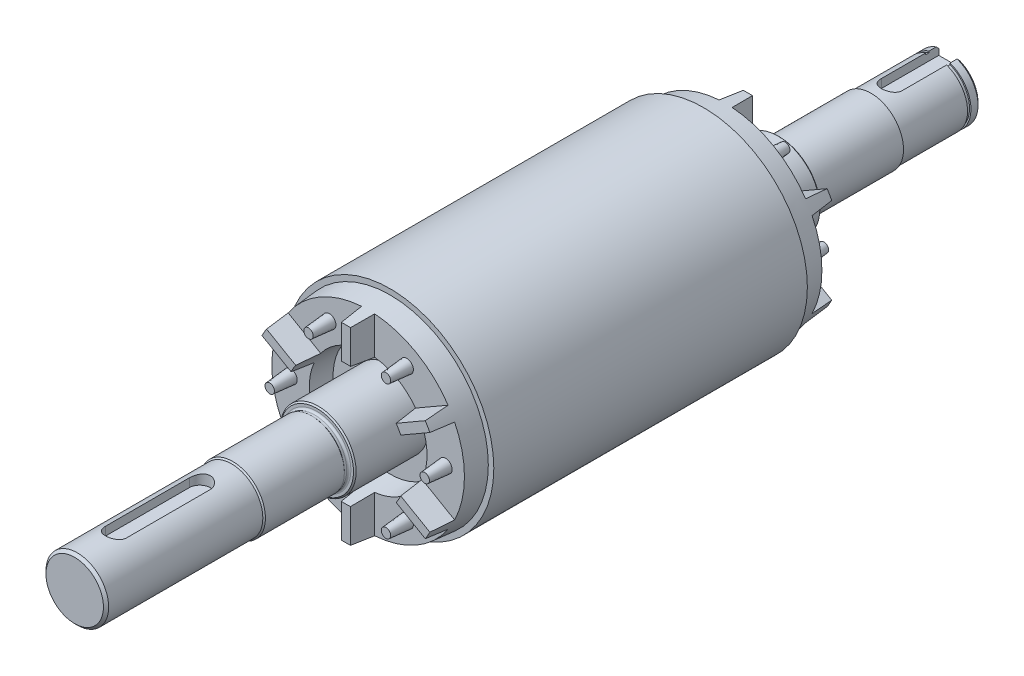
from build123d import *

# Parameters (mm, degrees)
SKETCH_1_R                 = 39.7
EXTRUDE_1_DEPTH            = 60
SKETCH_2_R                 = 37.6
SKETCH_2_R_2               = 21.8
EXTRUDE_2_DEPTH            = 8.4
EXTRUDE_2_DRAFT            = 5
EXTRUDE_3_DEPTH            = 8.5
EXTRUDE_3_DRAFT            = 5
EXTRUDE_3_PROFILE_2_DEPTH  = 8.5
EXTRUDE_3_PROFILE_2_DRAFT  = 5
EXTRUDE_3_PROFILE_3_DEPTH  = 8.5
EXTRUDE_3_PROFILE_3_DRAFT  = 5
EXTRUDE_3_PROFILE_4_DEPTH  = 8.5
EXTRUDE_3_PROFILE_4_DRAFT  = 5
EXTRUDE_3_PROFILE_5_DEPTH  = 8.5
EXTRUDE_3_PROFILE_5_DRAFT  = 5
EXTRUDE_3_PROFILE_6_DEPTH  = 8.5
EXTRUDE_3_PROFILE_6_DRAFT  = 5
SKETCH_4_R                 = 2.5
EXTRUDE_4_DEPTH            = 8
EXTRUDE_4_DRAFT            = 5
EXTRUDE_4_PROFILE_2_DEPTH  = 8
EXTRUDE_4_PROFILE_2_DRAFT  = 5
EXTRUDE_4_PROFILE_3_DEPTH  = 8
EXTRUDE_4_PROFILE_3_DRAFT  = 5
EXTRUDE_4_PROFILE_4_DEPTH  = 8
EXTRUDE_4_PROFILE_4_DRAFT  = 5
EXTRUDE_4_PROFILE_5_DEPTH  = 8
EXTRUDE_4_PROFILE_5_DRAFT  = 5
EXTRUDE_4_PROFILE_6_DEPTH  = 8
EXTRUDE_4_PROFILE_6_DRAFT  = 5
MIRROR_1_COPY_1_SKETCH_R   = 37.6
MIRROR_1_COPY_1_SKETCH_R_2 = 21.8
MIRROR_1_COPY_1_DEPTH      = 8.4
MIRROR_1_COPY_1_DRAFT      = 5
MIRROR_1_COPY_2_DEPTH      = 8.5
MIRROR_1_COPY_2_DRAFT      = 5
MIRROR_1_COPY_3_DEPTH      = 8.5
MIRROR_1_COPY_3_DRAFT      = 5
MIRROR_1_COPY_4_DEPTH      = 8.5
MIRROR_1_COPY_4_DRAFT      = 5
MIRROR_1_COPY_5_DEPTH      = 8.5
MIRROR_1_COPY_5_DRAFT      = 5
MIRROR_1_COPY_6_DEPTH      = 8.5
MIRROR_1_COPY_6_DRAFT      = 5
MIRROR_1_COPY_7_DEPTH      = 8.5
MIRROR_1_COPY_7_DRAFT      = 5
MIRROR_1_COPY_8_DEPTH      = 8.5
MIRROR_1_COPY_8_DRAFT      = 5
MIRROR_1_COPY_9_DEPTH      = 8.5
MIRROR_1_COPY_9_DRAFT      = 5
MIRROR_1_COPY_10_DEPTH     = 8.5
MIRROR_1_COPY_10_DRAFT     = 5
MIRROR_1_COPY_11_DEPTH     = 8.5
MIRROR_1_COPY_11_DRAFT     = 5
MIRROR_1_COPY_12_DEPTH     = 8.5
MIRROR_1_COPY_12_DRAFT     = 5
MIRROR_1_COPY_13_SKETCH_R  = 2.5
MIRROR_1_COPY_13_DEPTH     = 8
MIRROR_1_COPY_13_DRAFT     = 5
MIRROR_1_COPY_14_SKETCH_R  = 2.5
MIRROR_1_COPY_14_DEPTH     = 8
MIRROR_1_COPY_14_DRAFT     = 5
MIRROR_1_COPY_15_SKETCH_R  = 2.5
MIRROR_1_COPY_15_DEPTH     = 8
MIRROR_1_COPY_15_DRAFT     = 5
MIRROR_1_COPY_16_SKETCH_R  = 2.5
MIRROR_1_COPY_16_DEPTH     = 8
MIRROR_1_COPY_16_DRAFT     = 5
MIRROR_1_COPY_17_SKETCH_R  = 2.5
MIRROR_1_COPY_17_DEPTH     = 8
MIRROR_1_COPY_17_DRAFT     = 5
MIRROR_1_COPY_18_SKETCH_R  = 2.5
MIRROR_1_COPY_18_DEPTH     = 8
MIRROR_1_COPY_18_DRAFT     = 5
MIRROR_1_COPY_19_SKETCH_R  = 2.5
MIRROR_1_COPY_19_DEPTH     = 8
MIRROR_1_COPY_19_DRAFT     = 5
MIRROR_1_COPY_20_SKETCH_R  = 2.5
MIRROR_1_COPY_20_DEPTH     = 8
MIRROR_1_COPY_20_DRAFT     = 5
MIRROR_1_COPY_21_SKETCH_R  = 2.5
MIRROR_1_COPY_21_DEPTH     = 8
MIRROR_1_COPY_21_DRAFT     = 5
MIRROR_1_COPY_22_SKETCH_R  = 2.5
MIRROR_1_COPY_22_DEPTH     = 8
MIRROR_1_COPY_22_DRAFT     = 5
MIRROR_1_COPY_23_SKETCH_R  = 2.5
MIRROR_1_COPY_23_DEPTH     = 8
MIRROR_1_COPY_23_DRAFT     = 5
SKETCH_6_R                 = 14.5
EXTRUDE_5_DEPTH            = 28
SKETCH_7_R                 = 12.2
EXTRUDE_6_DEPTH            = 1.7
SKETCH_8_R                 = 12.5
EXTRUDE_7_DEPTH            = 31
FILLET_1_R                 = 0.8
CHAMFER_1_SIZE             = 0.3
CHAMFER_3_SIZE             = 0.5
SKETCH_9_R                 = 12
EXTRUDE_8_DEPTH            = 60
CHAMFER_4_SIZE             = 0.5
CHAMFER_5_SIZE             = 1
CUT_EXTRUDE_9_DEPTH        = 4
SKETCH_11_R                = 16
EXTRUDE_10_DEPTH           = 29
EXTRUDE_START              = 1.7
SKETCH_12_R                = 12.2
EXTRUDE_11_DEPTH           = 1.7
EXTRUDE_START_2            = 33.3
SKETCH_13_R                = 12.5
EXTRUDE_12_DEPTH           = 33.3
FILLET_2_R                 = 0.8
CHAMFER_6_SIZE             = 0.3
CHAMFER_7_SIZE             = 0.5
EXTRUDE_START_3            = 25
SKETCH_14_R                = 12
EXTRUDE_13_DEPTH           = 25
SKETCH_15_R                = 11.45
EXTRUDE_14_DEPTH           = 1.3
EXTRUDE_START_4            = 3.7
SKETCH_16_R                = 12
EXTRUDE_15_DEPTH           = 3.7
CHAMFER_8_SIZE             = 1
CUT_EXTRUDE_16_DEPTH       = 4
SCALE_1_SCALE              = 0.25


with BuildPart() as part:
    # 草图1 → 拉伸1 (new body)
    with BuildSketch(Plane.XY):
        Circle(SKETCH_1_R)
    extrude_1 = extrude(amount=EXTRUDE_1_DEPTH)


with BuildPart() as extrude_2_tool:
    # 草图2 → 拉伸2 (with draft: the straight prism first)
    with BuildSketch(Plane.XY.offset(60)):
        Circle(SKETCH_2_R)
        Circle(SKETCH_2_R_2, mode=Mode.SUBTRACT)
    extrude(amount=EXTRUDE_2_DEPTH)
    # 拉伸2: the draft: its side faces are tilted about the plane it starts from
    extrude_2_sides = [extrude_2_tool.faces().sort_by_distance(p)[0] for p in [
        (-37.6, 0, 64.2),
        (-21.8, 0, 64.2),
    ]]
    draft(extrude_2_sides, Plane.XY.offset(60), EXTRUDE_2_DRAFT)


with BuildPart() as part_1:
    add(part.part)

    # 拉伸2: add extrude_2_tool
    add(extrude_2_tool.part)


with BuildPart() as extrude_3_tool:
    # 草图3 → 拉伸3 (with draft: the straight prism first)
    with BuildSketch(Plane.XY.offset(68.4)):
        with BuildLine():
            ThreePointArc((18.145333198, 13.362964352), (19.515800006, 11.267452387), (20.645333198, 9.032837334))
            Line((20.645333198, 9.032837334), (33.10261268, 16.225050996))
            ThreePointArc((33.10261268, 16.225050996), (31.926108979, 18.432547613), (30.60261268, 20.555178015))
            Line((30.60261268, 20.555178015), (18.145333198, 13.362964352))
        make_face()
    extrude(amount=EXTRUDE_3_DEPTH)
    # 拉伸3: the draft: its side faces are tilted about the plane it starts from
    extrude_3_sides = [extrude_3_tool.faces().sort_by_distance(p)[0] for p in [
        (24.373972939, 16.959071184, 72.65),
        (19.515800006, 11.267452387, 72.65),
        (26.873972939, 12.628944165, 72.65),
        (31.926108979, 18.432547613, 72.65),
    ]]
    draft(extrude_3_sides, Plane.XY.offset(68.4), EXTRUDE_3_DRAFT)


with BuildPart() as part_2:
    add(part_1.part)

    # 拉伸3: add extrude_3_tool
    add(extrude_3_tool.part)


with BuildPart() as extrude_3_profile_2_tool:
    # 草图3 → 拉伸3 profile 2 (with draft: the straight prism first)
    with BuildSketch(Plane.XY.offset(68.4)):
        with BuildLine():
            Line((2.5, 22.395801686), (2.5, 36.78022901))
            ThreePointArc((2.5, 36.78022901), (0, 36.865095226), (-2.5, 36.78022901))
            Line((-2.5, 36.78022901), (-2.5, 22.395801686))
            ThreePointArc((-2.5, 22.395801686), (0, 22.534904774), (2.5, 22.395801686))
        make_face()
    extrude(amount=EXTRUDE_3_PROFILE_2_DEPTH)
    # 拉伸3 profile 2: the draft: its side faces are tilted about the plane it starts from
    extrude_3_profile_2_sides = [extrude_3_profile_2_tool.faces().sort_by_distance(p)[0] for p in [
        (2.5, 29.588015348, 72.65),
        (0, 36.865095226, 72.65),
        (-2.5, 29.588015348, 72.65),
        (0, 22.534904774, 72.65),
    ]]
    draft(extrude_3_profile_2_sides, Plane.XY.offset(68.4), EXTRUDE_3_PROFILE_2_DRAFT)


with BuildPart() as part_3:
    add(part_2.part)

    # 拉伸3 profile 2: add extrude_3_profile_2_tool
    add(extrude_3_profile_2_tool.part)


with BuildPart() as extrude_3_profile_3_tool:
    # 草图3 → 拉伸3 profile 3 (with draft: the straight prism first)
    with BuildSketch(Plane.XY.offset(68.4)):
        with BuildLine():
            ThreePointArc((20.645333198, -9.032837334), (19.515800006, -11.267452387), (18.145333198, -13.362964352))
            Line((18.145333198, -13.362964352), (30.60261268, -20.555178015))
            ThreePointArc((30.60261268, -20.555178015), (31.926108979, -18.432547613), (33.10261268, -16.225050996))
            Line((33.10261268, -16.225050996), (20.645333198, -9.032837334))
        make_face()
    extrude(amount=EXTRUDE_3_PROFILE_3_DEPTH)
    # 拉伸3 profile 3: the draft: its side faces are tilted about the plane it starts from
    extrude_3_profile_3_sides = [extrude_3_profile_3_tool.faces().sort_by_distance(p)[0] for p in [
        (31.926108979, -18.432547613, 72.65),
        (26.873972939, -12.628944165, 72.65),
        (19.515800006, -11.267452387, 72.65),
        (24.373972939, -16.959071184, 72.65),
    ]]
    draft(extrude_3_profile_3_sides, Plane.XY.offset(68.4), EXTRUDE_3_PROFILE_3_DRAFT)


with BuildPart() as part_4:
    add(part_3.part)

    # 拉伸3 profile 3: add extrude_3_profile_3_tool
    add(extrude_3_profile_3_tool.part)


with BuildPart() as extrude_3_profile_4_tool:
    # 草图3 → 拉伸3 profile 4 (with draft: the straight prism first)
    with BuildSketch(Plane.XY.offset(68.4)):
        with BuildLine():
            ThreePointArc((2.5, -22.395801686), (0, -22.534904774), (-2.5, -22.395801686))
            Line((-2.5, -22.395801686), (-2.5, -36.78022901))
            ThreePointArc((-2.5, -36.78022901), (0, -36.865095226), (2.5, -36.78022901))
            Line((2.5, -36.78022901), (2.5, -22.395801686))
        make_face()
    extrude(amount=EXTRUDE_3_PROFILE_4_DEPTH)
    # 拉伸3 profile 4: the draft: its side faces are tilted about the plane it starts from
    extrude_3_profile_4_sides = [extrude_3_profile_4_tool.faces().sort_by_distance(p)[0] for p in [
        (2.5, -29.588015348, 72.65),
        (0, -22.534904774, 72.65),
        (-2.5, -29.588015348, 72.65),
        (0, -36.865095226, 72.65),
    ]]
    draft(extrude_3_profile_4_sides, Plane.XY.offset(68.4), EXTRUDE_3_PROFILE_4_DRAFT)


with BuildPart() as part_5:
    add(part_4.part)

    # 拉伸3 profile 4: add extrude_3_profile_4_tool
    add(extrude_3_profile_4_tool.part)


with BuildPart() as extrude_3_profile_5_tool:
    # 草图3 → 拉伸3 profile 5 (with draft: the straight prism first)
    with BuildSketch(Plane.XY.offset(68.4)):
        with BuildLine():
            ThreePointArc((-18.145333198, -13.362964352), (-19.515800006, -11.267452387), (-20.645333198, -9.032837334))
            Line((-20.645333198, -9.032837334), (-33.10261268, -16.225050996))
            ThreePointArc((-33.10261268, -16.225050996), (-31.926108979, -18.432547613), (-30.60261268, -20.555178015))
            Line((-30.60261268, -20.555178015), (-18.145333198, -13.362964352))
        make_face()
    extrude(amount=EXTRUDE_3_PROFILE_5_DEPTH)
    # 拉伸3 profile 5: the draft: its side faces are tilted about the plane it starts from
    extrude_3_profile_5_sides = [extrude_3_profile_5_tool.faces().sort_by_distance(p)[0] for p in [
        (-24.373972939, -16.959071184, 72.65),
        (-19.515800006, -11.267452387, 72.65),
        (-26.873972939, -12.628944165, 72.65),
        (-31.926108979, -18.432547613, 72.65),
    ]]
    draft(extrude_3_profile_5_sides, Plane.XY.offset(68.4), EXTRUDE_3_PROFILE_5_DRAFT)


with BuildPart() as part_6:
    add(part_5.part)

    # 拉伸3 profile 5: add extrude_3_profile_5_tool
    add(extrude_3_profile_5_tool.part)


with BuildPart() as extrude_3_profile_6_tool:
    # 草图3 → 拉伸3 profile 6 (with draft: the straight prism first)
    with BuildSketch(Plane.XY.offset(68.4)):
        with BuildLine():
            ThreePointArc((-20.645333198, 9.032837334), (-19.515800006, 11.267452387), (-18.145333198, 13.362964352))
            Line((-18.145333198, 13.362964352), (-30.60261268, 20.555178015))
            ThreePointArc((-30.60261268, 20.555178015), (-31.926108979, 18.432547613), (-33.10261268, 16.225050996))
            Line((-33.10261268, 16.225050996), (-20.645333198, 9.032837334))
        make_face()
    extrude(amount=EXTRUDE_3_PROFILE_6_DEPTH)
    # 拉伸3 profile 6: the draft: its side faces are tilted about the plane it starts from
    extrude_3_profile_6_sides = [extrude_3_profile_6_tool.faces().sort_by_distance(p)[0] for p in [
        (-19.515800006, 11.267452387, 72.65),
        (-24.373972939, 16.959071184, 72.65),
        (-31.926108979, 18.432547613, 72.65),
        (-26.873972939, 12.628944165, 72.65),
    ]]
    draft(extrude_3_profile_6_sides, Plane.XY.offset(68.4), EXTRUDE_3_PROFILE_6_DRAFT)


with BuildPart() as part_7:
    add(part_6.part)

    # 拉伸3 profile 6: add extrude_3_profile_6_tool
    add(extrude_3_profile_6_tool.part)


with BuildPart() as extrude_4_tool:
    # 草图4 → 拉伸4 (with draft: the straight prism first)
    with BuildSketch(Plane.XY.offset(68.4)):
        with Locations((-29.650684789, 0)):
            Circle(SKETCH_4_R)
    extrude(amount=EXTRUDE_4_DEPTH)
    # 拉伸4: the draft: its side faces are tilted about the plane it starts from
    extrude_4_sides = [extrude_4_tool.faces().sort_by_distance(p)[0] for p in [
        (-32.150684789, 0, 72.4),
    ]]
    draft(extrude_4_sides, Plane.XY.offset(68.4), EXTRUDE_4_DRAFT)


with BuildPart() as part_8:
    add(part_7.part)

    # 拉伸4: add extrude_4_tool
    add(extrude_4_tool.part)


with BuildPart() as extrude_4_profile_2_tool:
    # 草图4 → 拉伸4 profile 2 (with draft: the straight prism first)
    with BuildSketch(Plane.XY.offset(68.4)):
        with Locations((-14.825342394, 25.678246267)):
            Circle(SKETCH_4_R)
    extrude(amount=EXTRUDE_4_PROFILE_2_DEPTH)
    # 拉伸4 profile 2: the draft: its side faces are tilted about the plane it starts from
    extrude_4_profile_2_sides = [extrude_4_profile_2_tool.faces().sort_by_distance(p)[0] for p in [
        (-17.325342394, 25.678246267, 72.4),
    ]]
    draft(extrude_4_profile_2_sides, Plane.XY.offset(68.4), EXTRUDE_4_PROFILE_2_DRAFT)


with BuildPart() as part_9:
    add(part_8.part)

    # 拉伸4 profile 2: add extrude_4_profile_2_tool
    add(extrude_4_profile_2_tool.part)


with BuildPart() as extrude_4_profile_3_tool:
    # 草图4 → 拉伸4 profile 3 (with draft: the straight prism first)
    with BuildSketch(Plane.XY.offset(68.4)):
        with Locations((14.825342394, 25.678246267)):
            Circle(SKETCH_4_R)
    extrude(amount=EXTRUDE_4_PROFILE_3_DEPTH)
    # 拉伸4 profile 3: the draft: its side faces are tilted about the plane it starts from
    extrude_4_profile_3_sides = [extrude_4_profile_3_tool.faces().sort_by_distance(p)[0] for p in [
        (12.325342394, 25.678246267, 72.4),
    ]]
    draft(extrude_4_profile_3_sides, Plane.XY.offset(68.4), EXTRUDE_4_PROFILE_3_DRAFT)


with BuildPart() as part_10:
    add(part_9.part)

    # 拉伸4 profile 3: add extrude_4_profile_3_tool
    add(extrude_4_profile_3_tool.part)


with BuildPart() as extrude_4_profile_4_tool:
    # 草图4 → 拉伸4 profile 4 (with draft: the straight prism first)
    with BuildSketch(Plane.XY.offset(68.4)):
        with Locations((29.650684789, 0)):
            Circle(SKETCH_4_R)
    extrude(amount=EXTRUDE_4_PROFILE_4_DEPTH)
    # 拉伸4 profile 4: the draft: its side faces are tilted about the plane it starts from
    extrude_4_profile_4_sides = [extrude_4_profile_4_tool.faces().sort_by_distance(p)[0] for p in [
        (27.150684789, 0, 72.4),
    ]]
    draft(extrude_4_profile_4_sides, Plane.XY.offset(68.4), EXTRUDE_4_PROFILE_4_DRAFT)


with BuildPart() as part_11:
    add(part_10.part)

    # 拉伸4 profile 4: add extrude_4_profile_4_tool
    add(extrude_4_profile_4_tool.part)


with BuildPart() as extrude_4_profile_5_tool:
    # 草图4 → 拉伸4 profile 5 (with draft: the straight prism first)
    with BuildSketch(Plane.XY.offset(68.4)):
        with Locations((14.825342394, -25.678246267)):
            Circle(SKETCH_4_R)
    extrude(amount=EXTRUDE_4_PROFILE_5_DEPTH)
    # 拉伸4 profile 5: the draft: its side faces are tilted about the plane it starts from
    extrude_4_profile_5_sides = [extrude_4_profile_5_tool.faces().sort_by_distance(p)[0] for p in [
        (12.325342394, -25.678246267, 72.4),
    ]]
    draft(extrude_4_profile_5_sides, Plane.XY.offset(68.4), EXTRUDE_4_PROFILE_5_DRAFT)


with BuildPart() as part_12:
    add(part_11.part)

    # 拉伸4 profile 5: add extrude_4_profile_5_tool
    add(extrude_4_profile_5_tool.part)


with BuildPart() as extrude_4_profile_6_tool:
    # 草图4 → 拉伸4 profile 6 (with draft: the straight prism first)
    with BuildSketch(Plane.XY.offset(68.4)):
        with Locations((-14.825342394, -25.678246267)):
            Circle(SKETCH_4_R)
    extrude(amount=EXTRUDE_4_PROFILE_6_DEPTH)
    # 拉伸4 profile 6: the draft: its side faces are tilted about the plane it starts from
    extrude_4_profile_6_sides = [extrude_4_profile_6_tool.faces().sort_by_distance(p)[0] for p in [
        (-17.325342394, -25.678246267, 72.4),
    ]]
    draft(extrude_4_profile_6_sides, Plane.XY.offset(68.4), EXTRUDE_4_PROFILE_6_DRAFT)


with BuildPart() as part_13:
    add(part_12.part)

    # 拉伸4 profile 6: add extrude_4_profile_6_tool
    add(extrude_4_profile_6_tool.part)

    # 镜向1: 拉伸1 across plane
    add(extrude_1.mirror(Plane.XY))


with BuildPart() as mirror_1_copy_1_tool:
    # 镜向1 copy 1 sketch → 镜向1 copy 1 (with draft: the straight prism first)
    with BuildSketch(Plane(origin=(0, 0, -60), x_dir=(1, 0, 0), z_dir=(0, 0, -1))):
        Circle(MIRROR_1_COPY_1_SKETCH_R)
        Circle(MIRROR_1_COPY_1_SKETCH_R_2, mode=Mode.SUBTRACT)
    extrude(amount=MIRROR_1_COPY_1_DEPTH)
    # 镜向1 copy 1: the draft: its side faces are tilted about the plane it starts from
    mirror_1_copy_1_sides = [mirror_1_copy_1_tool.faces().sort_by_distance(p)[0] for p in [
        (-37.6, 0, -64.2),
        (-21.8, 0, -64.2),
    ]]
    draft(mirror_1_copy_1_sides, Plane(origin=(0, 0, -60), x_dir=(1, 0, 0), z_dir=(0, 0, -1)), MIRROR_1_COPY_1_DRAFT)


with BuildPart() as part_14:
    add(part_13.part)

    # 镜向1 copy 1: add mirror_1_copy_1_tool
    add(mirror_1_copy_1_tool.part)


with BuildPart() as mirror_1_copy_2_tool:
    # 镜向1 copy 2 sketch → 镜向1 copy 2 (with draft: the straight prism first)
    with BuildSketch(Plane(origin=(0, 0, -68.4), x_dir=(1, 0, 0), z_dir=(0, 0, -1))):
        with BuildLine():
            ThreePointArc((18.145333198, -13.362964352), (19.515800006, -11.267452387), (20.645333198, -9.032837334))
            Line((20.645333198, -9.032837334), (33.10261268, -16.225050996))
            ThreePointArc((33.10261268, -16.225050996), (31.926108979, -18.432547613), (30.60261268, -20.555178015))
            Line((30.60261268, -20.555178015), (18.145333198, -13.362964352))
        make_face()
    extrude(amount=MIRROR_1_COPY_2_DEPTH)
    # 镜向1 copy 2: the draft: its side faces are tilted about the plane it starts from
    mirror_1_copy_2_sides = [mirror_1_copy_2_tool.faces().sort_by_distance(p)[0] for p in [
        (24.373972939, 16.959071184, -72.65),
        (19.515800006, 11.267452387, -72.65),
        (26.873972939, 12.628944165, -72.65),
        (31.926108979, 18.432547613, -72.65),
    ]]
    draft(mirror_1_copy_2_sides, Plane(origin=(0, 0, -68.4), x_dir=(1, 0, 0), z_dir=(0, 0, -1)), MIRROR_1_COPY_2_DRAFT)


with BuildPart() as part_15:
    add(part_14.part)

    # 镜向1 copy 2: add mirror_1_copy_2_tool
    add(mirror_1_copy_2_tool.part)


with BuildPart() as mirror_1_copy_3_tool:
    # 镜向1 copy 3 sketch → 镜向1 copy 3 (with draft: the straight prism first)
    with BuildSketch(Plane(origin=(0, 0, -68.4), x_dir=(1, 0, 0), z_dir=(0, 0, -1))):
        with BuildLine():
            Line((2.5, -22.395801686), (2.5, -36.78022901))
            ThreePointArc((2.5, -36.78022901), (0, -36.865095226), (-2.5, -36.78022901))
            Line((-2.5, -36.78022901), (-2.5, -22.395801686))
            ThreePointArc((-2.5, -22.395801686), (0, -22.534904774), (2.5, -22.395801686))
        make_face()
    extrude(amount=MIRROR_1_COPY_3_DEPTH)
    # 镜向1 copy 3: the draft: its side faces are tilted about the plane it starts from
    mirror_1_copy_3_sides = [mirror_1_copy_3_tool.faces().sort_by_distance(p)[0] for p in [
        (2.5, 29.588015348, -72.65),
        (0, 36.865095226, -72.65),
        (-2.5, 29.588015348, -72.65),
        (0, 22.534904774, -72.65),
    ]]
    draft(mirror_1_copy_3_sides, Plane(origin=(0, 0, -68.4), x_dir=(1, 0, 0), z_dir=(0, 0, -1)), MIRROR_1_COPY_3_DRAFT)


with BuildPart() as part_16:
    add(part_15.part)

    # 镜向1 copy 3: add mirror_1_copy_3_tool
    add(mirror_1_copy_3_tool.part)


with BuildPart() as mirror_1_copy_4_tool:
    # 镜向1 copy 4 sketch → 镜向1 copy 4 (with draft: the straight prism first)
    with BuildSketch(Plane(origin=(0, 0, -68.4), x_dir=(1, 0, 0), z_dir=(0, 0, -1))):
        with BuildLine():
            ThreePointArc((20.645333198, 9.032837334), (19.515800006, 11.267452387), (18.145333198, 13.362964352))
            Line((18.145333198, 13.362964352), (30.60261268, 20.555178015))
            ThreePointArc((30.60261268, 20.555178015), (31.926108979, 18.432547613), (33.10261268, 16.225050996))
            Line((33.10261268, 16.225050996), (20.645333198, 9.032837334))
        make_face()
    extrude(amount=MIRROR_1_COPY_4_DEPTH)
    # 镜向1 copy 4: the draft: its side faces are tilted about the plane it starts from
    mirror_1_copy_4_sides = [mirror_1_copy_4_tool.faces().sort_by_distance(p)[0] for p in [
        (31.926108979, -18.432547613, -72.65),
        (26.873972939, -12.628944165, -72.65),
        (19.515800006, -11.267452387, -72.65),
        (24.373972939, -16.959071184, -72.65),
    ]]
    draft(mirror_1_copy_4_sides, Plane(origin=(0, 0, -68.4), x_dir=(1, 0, 0), z_dir=(0, 0, -1)), MIRROR_1_COPY_4_DRAFT)


with BuildPart() as part_17:
    add(part_16.part)

    # 镜向1 copy 4: add mirror_1_copy_4_tool
    add(mirror_1_copy_4_tool.part)


with BuildPart() as mirror_1_copy_5_tool:
    # 镜向1 copy 5 sketch → 镜向1 copy 5 (with draft: the straight prism first)
    with BuildSketch(Plane(origin=(0, 0, -68.4), x_dir=(1, 0, 0), z_dir=(0, 0, -1))):
        with BuildLine():
            ThreePointArc((2.5, 22.395801686), (0, 22.534904774), (-2.5, 22.395801686))
            Line((-2.5, 22.395801686), (-2.5, 36.78022901))
            ThreePointArc((-2.5, 36.78022901), (0, 36.865095226), (2.5, 36.78022901))
            Line((2.5, 36.78022901), (2.5, 22.395801686))
        make_face()
    extrude(amount=MIRROR_1_COPY_5_DEPTH)
    # 镜向1 copy 5: the draft: its side faces are tilted about the plane it starts from
    mirror_1_copy_5_sides = [mirror_1_copy_5_tool.faces().sort_by_distance(p)[0] for p in [
        (2.5, -29.588015348, -72.65),
        (0, -22.534904774, -72.65),
        (-2.5, -29.588015348, -72.65),
        (0, -36.865095226, -72.65),
    ]]
    draft(mirror_1_copy_5_sides, Plane(origin=(0, 0, -68.4), x_dir=(1, 0, 0), z_dir=(0, 0, -1)), MIRROR_1_COPY_5_DRAFT)


with BuildPart() as part_18:
    add(part_17.part)

    # 镜向1 copy 5: add mirror_1_copy_5_tool
    add(mirror_1_copy_5_tool.part)


with BuildPart() as mirror_1_copy_6_tool:
    # 镜向1 copy 6 sketch → 镜向1 copy 6 (with draft: the straight prism first)
    with BuildSketch(Plane(origin=(0, 0, -68.4), x_dir=(1, 0, 0), z_dir=(0, 0, -1))):
        with BuildLine():
            ThreePointArc((-18.145333198, 13.362964352), (-19.515800006, 11.267452387), (-20.645333198, 9.032837334))
            Line((-20.645333198, 9.032837334), (-33.10261268, 16.225050996))
            ThreePointArc((-33.10261268, 16.225050996), (-31.926108979, 18.432547613), (-30.60261268, 20.555178015))
            Line((-30.60261268, 20.555178015), (-18.145333198, 13.362964352))
        make_face()
    extrude(amount=MIRROR_1_COPY_6_DEPTH)
    # 镜向1 copy 6: the draft: its side faces are tilted about the plane it starts from
    mirror_1_copy_6_sides = [mirror_1_copy_6_tool.faces().sort_by_distance(p)[0] for p in [
        (-24.373972939, -16.959071184, -72.65),
        (-19.515800006, -11.267452387, -72.65),
        (-26.873972939, -12.628944165, -72.65),
        (-31.926108979, -18.432547613, -72.65),
    ]]
    draft(mirror_1_copy_6_sides, Plane(origin=(0, 0, -68.4), x_dir=(1, 0, 0), z_dir=(0, 0, -1)), MIRROR_1_COPY_6_DRAFT)


with BuildPart() as part_19:
    add(part_18.part)

    # 镜向1 copy 6: add mirror_1_copy_6_tool
    add(mirror_1_copy_6_tool.part)


with BuildPart() as mirror_1_copy_7_tool:
    # 镜向1 copy 7 sketch → 镜向1 copy 7 (with draft: the straight prism first)
    with BuildSketch(Plane(origin=(0, 0, -68.4), x_dir=(1, 0, 0), z_dir=(0, 0, -1))):
        with BuildLine():
            ThreePointArc((-20.645333198, -9.032837334), (-19.515800006, -11.267452387), (-18.145333198, -13.362964352))
            Line((-18.145333198, -13.362964352), (-30.60261268, -20.555178015))
            ThreePointArc((-30.60261268, -20.555178015), (-31.926108979, -18.432547613), (-33.10261268, -16.225050996))
            Line((-33.10261268, -16.225050996), (-20.645333198, -9.032837334))
        make_face()
    extrude(amount=MIRROR_1_COPY_7_DEPTH)
    # 镜向1 copy 7: the draft: its side faces are tilted about the plane it starts from
    mirror_1_copy_7_sides = [mirror_1_copy_7_tool.faces().sort_by_distance(p)[0] for p in [
        (-19.515800006, 11.267452387, -72.65),
        (-24.373972939, 16.959071184, -72.65),
        (-31.926108979, 18.432547613, -72.65),
        (-26.873972939, 12.628944165, -72.65),
    ]]
    draft(mirror_1_copy_7_sides, Plane(origin=(0, 0, -68.4), x_dir=(1, 0, 0), z_dir=(0, 0, -1)), MIRROR_1_COPY_7_DRAFT)


with BuildPart() as part_20:
    add(part_19.part)

    # 镜向1 copy 7: add mirror_1_copy_7_tool
    add(mirror_1_copy_7_tool.part)


with BuildPart() as mirror_1_copy_8_tool:
    # 镜向1 copy 8 sketch → 镜向1 copy 8 (with draft: the straight prism first)
    with BuildSketch(Plane(origin=(0, 0, -68.4), x_dir=(1, 0, 0), z_dir=(0, 0, -1))):
        with BuildLine():
            Line((2.5, -22.395801686), (2.5, -36.78022901))
            ThreePointArc((2.5, -36.78022901), (0, -36.865095226), (-2.5, -36.78022901))
            Line((-2.5, -36.78022901), (-2.5, -22.395801686))
            ThreePointArc((-2.5, -22.395801686), (0, -22.534904774), (2.5, -22.395801686))
        make_face()
    extrude(amount=MIRROR_1_COPY_8_DEPTH)
    # 镜向1 copy 8: the draft: its side faces are tilted about the plane it starts from
    mirror_1_copy_8_sides = [mirror_1_copy_8_tool.faces().sort_by_distance(p)[0] for p in [
        (2.5, 29.588015348, -72.65),
        (0, 36.865095226, -72.65),
        (-2.5, 29.588015348, -72.65),
        (0, 22.534904774, -72.65),
    ]]
    draft(mirror_1_copy_8_sides, Plane(origin=(0, 0, -68.4), x_dir=(1, 0, 0), z_dir=(0, 0, -1)), MIRROR_1_COPY_8_DRAFT)


with BuildPart() as part_21:
    add(part_20.part)

    # 镜向1 copy 8: add mirror_1_copy_8_tool
    add(mirror_1_copy_8_tool.part)


with BuildPart() as mirror_1_copy_9_tool:
    # 镜向1 copy 9 sketch → 镜向1 copy 9 (with draft: the straight prism first)
    with BuildSketch(Plane(origin=(0, 0, -68.4), x_dir=(1, 0, 0), z_dir=(0, 0, -1))):
        with BuildLine():
            ThreePointArc((20.645333198, 9.032837334), (19.515800006, 11.267452387), (18.145333198, 13.362964352))
            Line((18.145333198, 13.362964352), (30.60261268, 20.555178015))
            ThreePointArc((30.60261268, 20.555178015), (31.926108979, 18.432547613), (33.10261268, 16.225050996))
            Line((33.10261268, 16.225050996), (20.645333198, 9.032837334))
        make_face()
    extrude(amount=MIRROR_1_COPY_9_DEPTH)
    # 镜向1 copy 9: the draft: its side faces are tilted about the plane it starts from
    mirror_1_copy_9_sides = [mirror_1_copy_9_tool.faces().sort_by_distance(p)[0] for p in [
        (31.926108979, -18.432547613, -72.65),
        (26.873972939, -12.628944165, -72.65),
        (19.515800006, -11.267452387, -72.65),
        (24.373972939, -16.959071184, -72.65),
    ]]
    draft(mirror_1_copy_9_sides, Plane(origin=(0, 0, -68.4), x_dir=(1, 0, 0), z_dir=(0, 0, -1)), MIRROR_1_COPY_9_DRAFT)


with BuildPart() as part_22:
    add(part_21.part)

    # 镜向1 copy 9: add mirror_1_copy_9_tool
    add(mirror_1_copy_9_tool.part)


with BuildPart() as mirror_1_copy_10_tool:
    # 镜向1 copy 10 sketch → 镜向1 copy 10 (with draft: the straight prism first)
    with BuildSketch(Plane(origin=(0, 0, -68.4), x_dir=(1, 0, 0), z_dir=(0, 0, -1))):
        with BuildLine():
            ThreePointArc((2.5, 22.395801686), (0, 22.534904774), (-2.5, 22.395801686))
            Line((-2.5, 22.395801686), (-2.5, 36.78022901))
            ThreePointArc((-2.5, 36.78022901), (0, 36.865095226), (2.5, 36.78022901))
            Line((2.5, 36.78022901), (2.5, 22.395801686))
        make_face()
    extrude(amount=MIRROR_1_COPY_10_DEPTH)
    # 镜向1 copy 10: the draft: its side faces are tilted about the plane it starts from
    mirror_1_copy_10_sides = [mirror_1_copy_10_tool.faces().sort_by_distance(p)[0] for p in [
        (2.5, -29.588015348, -72.65),
        (0, -22.534904774, -72.65),
        (-2.5, -29.588015348, -72.65),
        (0, -36.865095226, -72.65),
    ]]
    draft(mirror_1_copy_10_sides, Plane(origin=(0, 0, -68.4), x_dir=(1, 0, 0), z_dir=(0, 0, -1)), MIRROR_1_COPY_10_DRAFT)


with BuildPart() as part_23:
    add(part_22.part)

    # 镜向1 copy 10: add mirror_1_copy_10_tool
    add(mirror_1_copy_10_tool.part)


with BuildPart() as mirror_1_copy_11_tool:
    # 镜向1 copy 11 sketch → 镜向1 copy 11 (with draft: the straight prism first)
    with BuildSketch(Plane(origin=(0, 0, -68.4), x_dir=(1, 0, 0), z_dir=(0, 0, -1))):
        with BuildLine():
            ThreePointArc((-18.145333198, 13.362964352), (-19.515800006, 11.267452387), (-20.645333198, 9.032837334))
            Line((-20.645333198, 9.032837334), (-33.10261268, 16.225050996))
            ThreePointArc((-33.10261268, 16.225050996), (-31.926108979, 18.432547613), (-30.60261268, 20.555178015))
            Line((-30.60261268, 20.555178015), (-18.145333198, 13.362964352))
        make_face()
    extrude(amount=MIRROR_1_COPY_11_DEPTH)
    # 镜向1 copy 11: the draft: its side faces are tilted about the plane it starts from
    mirror_1_copy_11_sides = [mirror_1_copy_11_tool.faces().sort_by_distance(p)[0] for p in [
        (-24.373972939, -16.959071184, -72.65),
        (-19.515800006, -11.267452387, -72.65),
        (-26.873972939, -12.628944165, -72.65),
        (-31.926108979, -18.432547613, -72.65),
    ]]
    draft(mirror_1_copy_11_sides, Plane(origin=(0, 0, -68.4), x_dir=(1, 0, 0), z_dir=(0, 0, -1)), MIRROR_1_COPY_11_DRAFT)


with BuildPart() as part_24:
    add(part_23.part)

    # 镜向1 copy 11: add mirror_1_copy_11_tool
    add(mirror_1_copy_11_tool.part)


with BuildPart() as mirror_1_copy_12_tool:
    # 镜向1 copy 12 sketch → 镜向1 copy 12 (with draft: the straight prism first)
    with BuildSketch(Plane(origin=(0, 0, -68.4), x_dir=(1, 0, 0), z_dir=(0, 0, -1))):
        with BuildLine():
            ThreePointArc((-20.645333198, -9.032837334), (-19.515800006, -11.267452387), (-18.145333198, -13.362964352))
            Line((-18.145333198, -13.362964352), (-30.60261268, -20.555178015))
            ThreePointArc((-30.60261268, -20.555178015), (-31.926108979, -18.432547613), (-33.10261268, -16.225050996))
            Line((-33.10261268, -16.225050996), (-20.645333198, -9.032837334))
        make_face()
    extrude(amount=MIRROR_1_COPY_12_DEPTH)
    # 镜向1 copy 12: the draft: its side faces are tilted about the plane it starts from
    mirror_1_copy_12_sides = [mirror_1_copy_12_tool.faces().sort_by_distance(p)[0] for p in [
        (-19.515800006, 11.267452387, -72.65),
        (-24.373972939, 16.959071184, -72.65),
        (-31.926108979, 18.432547613, -72.65),
        (-26.873972939, 12.628944165, -72.65),
    ]]
    draft(mirror_1_copy_12_sides, Plane(origin=(0, 0, -68.4), x_dir=(1, 0, 0), z_dir=(0, 0, -1)), MIRROR_1_COPY_12_DRAFT)


with BuildPart() as part_25:
    add(part_24.part)

    # 镜向1 copy 12: add mirror_1_copy_12_tool
    add(mirror_1_copy_12_tool.part)


with BuildPart() as mirror_1_copy_13_tool:
    # 镜向1 copy 13 sketch → 镜向1 copy 13 (with draft: the straight prism first)
    with BuildSketch(Plane(origin=(0, 0, -68.4), x_dir=(1, 0, 0), z_dir=(0, 0, -1))):
        with Locations((-29.650684789, 0)):
            Circle(MIRROR_1_COPY_13_SKETCH_R)
    extrude(amount=MIRROR_1_COPY_13_DEPTH)
    # 镜向1 copy 13: the draft: its side faces are tilted about the plane it starts from
    mirror_1_copy_13_sides = [mirror_1_copy_13_tool.faces().sort_by_distance(p)[0] for p in [
        (-32.150684789, 0, -72.4),
    ]]
    draft(mirror_1_copy_13_sides, Plane(origin=(0, 0, -68.4), x_dir=(1, 0, 0), z_dir=(0, 0, -1)), MIRROR_1_COPY_13_DRAFT)


with BuildPart() as part_26:
    add(part_25.part)

    # 镜向1 copy 13: add mirror_1_copy_13_tool
    add(mirror_1_copy_13_tool.part)


with BuildPart() as mirror_1_copy_14_tool:
    # 镜向1 copy 14 sketch → 镜向1 copy 14 (with draft: the straight prism first)
    with BuildSketch(Plane(origin=(0, 0, -68.4), x_dir=(1, 0, 0), z_dir=(0, 0, -1))):
        with Locations((-14.825342394, -25.678246267)):
            Circle(MIRROR_1_COPY_14_SKETCH_R)
    extrude(amount=MIRROR_1_COPY_14_DEPTH)
    # 镜向1 copy 14: the draft: its side faces are tilted about the plane it starts from
    mirror_1_copy_14_sides = [mirror_1_copy_14_tool.faces().sort_by_distance(p)[0] for p in [
        (-17.325342394, 25.678246267, -72.4),
    ]]
    draft(mirror_1_copy_14_sides, Plane(origin=(0, 0, -68.4), x_dir=(1, 0, 0), z_dir=(0, 0, -1)), MIRROR_1_COPY_14_DRAFT)


with BuildPart() as part_27:
    add(part_26.part)

    # 镜向1 copy 14: add mirror_1_copy_14_tool
    add(mirror_1_copy_14_tool.part)


with BuildPart() as mirror_1_copy_15_tool:
    # 镜向1 copy 15 sketch → 镜向1 copy 15 (with draft: the straight prism first)
    with BuildSketch(Plane(origin=(0, 0, -68.4), x_dir=(1, 0, 0), z_dir=(0, 0, -1))):
        with Locations((14.825342394, -25.678246267)):
            Circle(MIRROR_1_COPY_15_SKETCH_R)
    extrude(amount=MIRROR_1_COPY_15_DEPTH)
    # 镜向1 copy 15: the draft: its side faces are tilted about the plane it starts from
    mirror_1_copy_15_sides = [mirror_1_copy_15_tool.faces().sort_by_distance(p)[0] for p in [
        (12.325342394, 25.678246267, -72.4),
    ]]
    draft(mirror_1_copy_15_sides, Plane(origin=(0, 0, -68.4), x_dir=(1, 0, 0), z_dir=(0, 0, -1)), MIRROR_1_COPY_15_DRAFT)


with BuildPart() as part_28:
    add(part_27.part)

    # 镜向1 copy 15: add mirror_1_copy_15_tool
    add(mirror_1_copy_15_tool.part)


with BuildPart() as mirror_1_copy_16_tool:
    # 镜向1 copy 16 sketch → 镜向1 copy 16 (with draft: the straight prism first)
    with BuildSketch(Plane(origin=(0, 0, -68.4), x_dir=(1, 0, 0), z_dir=(0, 0, -1))):
        with Locations((29.650684789, 0)):
            Circle(MIRROR_1_COPY_16_SKETCH_R)
    extrude(amount=MIRROR_1_COPY_16_DEPTH)
    # 镜向1 copy 16: the draft: its side faces are tilted about the plane it starts from
    mirror_1_copy_16_sides = [mirror_1_copy_16_tool.faces().sort_by_distance(p)[0] for p in [
        (27.150684789, 0, -72.4),
    ]]
    draft(mirror_1_copy_16_sides, Plane(origin=(0, 0, -68.4), x_dir=(1, 0, 0), z_dir=(0, 0, -1)), MIRROR_1_COPY_16_DRAFT)


with BuildPart() as part_29:
    add(part_28.part)

    # 镜向1 copy 16: add mirror_1_copy_16_tool
    add(mirror_1_copy_16_tool.part)


with BuildPart() as mirror_1_copy_17_tool:
    # 镜向1 copy 17 sketch → 镜向1 copy 17 (with draft: the straight prism first)
    with BuildSketch(Plane(origin=(0, 0, -68.4), x_dir=(1, 0, 0), z_dir=(0, 0, -1))):
        with Locations((14.825342394, 25.678246267)):
            Circle(MIRROR_1_COPY_17_SKETCH_R)
    extrude(amount=MIRROR_1_COPY_17_DEPTH)
    # 镜向1 copy 17: the draft: its side faces are tilted about the plane it starts from
    mirror_1_copy_17_sides = [mirror_1_copy_17_tool.faces().sort_by_distance(p)[0] for p in [
        (12.325342394, -25.678246267, -72.4),
    ]]
    draft(mirror_1_copy_17_sides, Plane(origin=(0, 0, -68.4), x_dir=(1, 0, 0), z_dir=(0, 0, -1)), MIRROR_1_COPY_17_DRAFT)


with BuildPart() as part_30:
    add(part_29.part)

    # 镜向1 copy 17: add mirror_1_copy_17_tool
    add(mirror_1_copy_17_tool.part)


with BuildPart() as mirror_1_copy_18_tool:
    # 镜向1 copy 18 sketch → 镜向1 copy 18 (with draft: the straight prism first)
    with BuildSketch(Plane(origin=(0, 0, -68.4), x_dir=(1, 0, 0), z_dir=(0, 0, -1))):
        with Locations((-14.825342394, 25.678246267)):
            Circle(MIRROR_1_COPY_18_SKETCH_R)
    extrude(amount=MIRROR_1_COPY_18_DEPTH)
    # 镜向1 copy 18: the draft: its side faces are tilted about the plane it starts from
    mirror_1_copy_18_sides = [mirror_1_copy_18_tool.faces().sort_by_distance(p)[0] for p in [
        (-17.325342394, -25.678246267, -72.4),
    ]]
    draft(mirror_1_copy_18_sides, Plane(origin=(0, 0, -68.4), x_dir=(1, 0, 0), z_dir=(0, 0, -1)), MIRROR_1_COPY_18_DRAFT)


with BuildPart() as part_31:
    add(part_30.part)

    # 镜向1 copy 18: add mirror_1_copy_18_tool
    add(mirror_1_copy_18_tool.part)


with BuildPart() as mirror_1_copy_19_tool:
    # 镜向1 copy 19 sketch → 镜向1 copy 19 (with draft: the straight prism first)
    with BuildSketch(Plane(origin=(0, 0, -68.4), x_dir=(1, 0, 0), z_dir=(0, 0, -1))):
        with Locations((-14.825342394, -25.678246267)):
            Circle(MIRROR_1_COPY_19_SKETCH_R)
    extrude(amount=MIRROR_1_COPY_19_DEPTH)
    # 镜向1 copy 19: the draft: its side faces are tilted about the plane it starts from
    mirror_1_copy_19_sides = [mirror_1_copy_19_tool.faces().sort_by_distance(p)[0] for p in [
        (-17.325342394, 25.678246267, -72.4),
    ]]
    draft(mirror_1_copy_19_sides, Plane(origin=(0, 0, -68.4), x_dir=(1, 0, 0), z_dir=(0, 0, -1)), MIRROR_1_COPY_19_DRAFT)


with BuildPart() as part_32:
    add(part_31.part)

    # 镜向1 copy 19: add mirror_1_copy_19_tool
    add(mirror_1_copy_19_tool.part)


with BuildPart() as mirror_1_copy_20_tool:
    # 镜向1 copy 20 sketch → 镜向1 copy 20 (with draft: the straight prism first)
    with BuildSketch(Plane(origin=(0, 0, -68.4), x_dir=(1, 0, 0), z_dir=(0, 0, -1))):
        with Locations((14.825342394, -25.678246267)):
            Circle(MIRROR_1_COPY_20_SKETCH_R)
    extrude(amount=MIRROR_1_COPY_20_DEPTH)
    # 镜向1 copy 20: the draft: its side faces are tilted about the plane it starts from
    mirror_1_copy_20_sides = [mirror_1_copy_20_tool.faces().sort_by_distance(p)[0] for p in [
        (12.325342394, 25.678246267, -72.4),
    ]]
    draft(mirror_1_copy_20_sides, Plane(origin=(0, 0, -68.4), x_dir=(1, 0, 0), z_dir=(0, 0, -1)), MIRROR_1_COPY_20_DRAFT)


with BuildPart() as part_33:
    add(part_32.part)

    # 镜向1 copy 20: add mirror_1_copy_20_tool
    add(mirror_1_copy_20_tool.part)


with BuildPart() as mirror_1_copy_21_tool:
    # 镜向1 copy 21 sketch → 镜向1 copy 21 (with draft: the straight prism first)
    with BuildSketch(Plane(origin=(0, 0, -68.4), x_dir=(1, 0, 0), z_dir=(0, 0, -1))):
        with Locations((29.650684789, 0)):
            Circle(MIRROR_1_COPY_21_SKETCH_R)
    extrude(amount=MIRROR_1_COPY_21_DEPTH)
    # 镜向1 copy 21: the draft: its side faces are tilted about the plane it starts from
    mirror_1_copy_21_sides = [mirror_1_copy_21_tool.faces().sort_by_distance(p)[0] for p in [
        (27.150684789, 0, -72.4),
    ]]
    draft(mirror_1_copy_21_sides, Plane(origin=(0, 0, -68.4), x_dir=(1, 0, 0), z_dir=(0, 0, -1)), MIRROR_1_COPY_21_DRAFT)


with BuildPart() as part_34:
    add(part_33.part)

    # 镜向1 copy 21: add mirror_1_copy_21_tool
    add(mirror_1_copy_21_tool.part)


with BuildPart() as mirror_1_copy_22_tool:
    # 镜向1 copy 22 sketch → 镜向1 copy 22 (with draft: the straight prism first)
    with BuildSketch(Plane(origin=(0, 0, -68.4), x_dir=(1, 0, 0), z_dir=(0, 0, -1))):
        with Locations((14.825342394, 25.678246267)):
            Circle(MIRROR_1_COPY_22_SKETCH_R)
    extrude(amount=MIRROR_1_COPY_22_DEPTH)
    # 镜向1 copy 22: the draft: its side faces are tilted about the plane it starts from
    mirror_1_copy_22_sides = [mirror_1_copy_22_tool.faces().sort_by_distance(p)[0] for p in [
        (12.325342394, -25.678246267, -72.4),
    ]]
    draft(mirror_1_copy_22_sides, Plane(origin=(0, 0, -68.4), x_dir=(1, 0, 0), z_dir=(0, 0, -1)), MIRROR_1_COPY_22_DRAFT)


with BuildPart() as part_35:
    add(part_34.part)

    # 镜向1 copy 22: add mirror_1_copy_22_tool
    add(mirror_1_copy_22_tool.part)


with BuildPart() as mirror_1_copy_23_tool:
    # 镜向1 copy 23 sketch → 镜向1 copy 23 (with draft: the straight prism first)
    with BuildSketch(Plane(origin=(0, 0, -68.4), x_dir=(1, 0, 0), z_dir=(0, 0, -1))):
        with Locations((-14.825342394, 25.678246267)):
            Circle(MIRROR_1_COPY_23_SKETCH_R)
    extrude(amount=MIRROR_1_COPY_23_DEPTH)
    # 镜向1 copy 23: the draft: its side faces are tilted about the plane it starts from
    mirror_1_copy_23_sides = [mirror_1_copy_23_tool.faces().sort_by_distance(p)[0] for p in [
        (-17.325342394, -25.678246267, -72.4),
    ]]
    draft(mirror_1_copy_23_sides, Plane(origin=(0, 0, -68.4), x_dir=(1, 0, 0), z_dir=(0, 0, -1)), MIRROR_1_COPY_23_DRAFT)


with BuildPart() as part_36:
    add(part_35.part)

    # 镜向1 copy 23: add mirror_1_copy_23_tool
    add(mirror_1_copy_23_tool.part)

    # 草图6 → 拉伸5 (add)
    with BuildSketch(Plane.XY.offset(60)):
        Circle(SKETCH_6_R)
    extrude(amount=EXTRUDE_5_DEPTH)

    # 草图7 → 拉伸6 (add)
    with BuildSketch(Plane.XY.offset(88)):
        Circle(SKETCH_7_R)
    extrude(amount=EXTRUDE_6_DEPTH)

    # 草图8 → 拉伸7 (add)
    with BuildSketch(Plane.XY.offset(89.7)):
        Circle(SKETCH_8_R)
    extrude(amount=EXTRUDE_7_DEPTH)

    # 圆角1
    fillet_1_edges = [part_36.edges().sort_by_distance(p)[0] for p in [
        (-12.2, 0, 88),
    ]]
    fillet(fillet_1_edges, radius=FILLET_1_R)

    # 倒角1
    chamfer_1_edges = [part_36.edges().sort_by_distance(p)[0] for p in [
        (-12.5, 0, 89.7),
    ]]
    chamfer(chamfer_1_edges, length=CHAMFER_1_SIZE - 0.0001)  # a hair under: the kernel refuses the full size

    # 倒角3
    chamfer_3_edges = [part_36.edges().sort_by_distance(p)[0] for p in [
        (-14.5, 0, 88),
    ]]
    chamfer(chamfer_3_edges, length=CHAMFER_3_SIZE)

    # 草图9 → 拉伸8 (add)
    with BuildSketch(Plane.XY.offset(120.7)):
        Circle(SKETCH_9_R)
    extrude(amount=EXTRUDE_8_DEPTH)

    # 倒角4
    chamfer_4_edges = [part_36.edges().sort_by_distance(p)[0] for p in [
        (-12.5, 0, 120.7),
    ]]
    chamfer(chamfer_4_edges, length=CHAMFER_4_SIZE - 0.0001)  # a hair under: the kernel refuses the full size

    # 倒角5
    chamfer_5_edges = [part_36.edges().sort_by_distance(p)[0] for p in [
        (-12, 0, 180.7),
    ]]
    chamfer(chamfer_5_edges, length=CHAMFER_5_SIZE)

    # 草图10 → 拉伸9 (cut)
    with BuildSketch(Plane(origin=(0, 12, 0), x_dir=(-1, 0, 0), z_dir=(0, 1, 0))):
        with BuildLine():
            Line((4.139020978, 132.7), (4.139020978, 164.7))
            ThreePointArc((4.139020978, 164.7), (0.139020978, 168.7), (-3.860979022, 164.7))
            Line((-3.860979022, 164.7), (-3.860979022, 132.7))
            ThreePointArc((-3.860979022, 132.7), (0.139020978, 128.7), (4.139020978, 132.7))
        make_face()
    extrude(amount=-CUT_EXTRUDE_9_DEPTH, mode=Mode.SUBTRACT)

    # 草图11 → 拉伸10 (add)
    with BuildSketch(Plane(origin=(0, 0, -60), x_dir=(-1, 0, 0), z_dir=(0, 0, -1))):
        with Locations(Location((0, 0, 0), (0, 0, 180))):
            Circle(SKETCH_11_R)
    extrude(amount=EXTRUDE_10_DEPTH)

    # 草图12 → 拉伸11 (add)
    with BuildSketch(Plane(origin=(0, 0, -89), x_dir=(-1, 0, 0), z_dir=(0, 0, -1)).offset(EXTRUDE_START)):
        with Locations(Location((0, 0, 0), (0, 0, 180))):
            Circle(SKETCH_12_R)
    extrude(amount=-EXTRUDE_11_DEPTH)

    # 草图13 → 拉伸12 (add)
    with BuildSketch(Plane(origin=(0, 0, -90.7), x_dir=(-1, 0, 0), z_dir=(0, 0, -1)).offset(EXTRUDE_START_2)):
        with Locations(Location((0, 0, 0), (0, 0, 180))):
            Circle(SKETCH_13_R)
    extrude(amount=-EXTRUDE_12_DEPTH)

    # 圆角2
    fillet_2_edges = [part_36.edges().sort_by_distance(p)[0] for p in [
        (-12.2, 0, -89),
    ]]
    fillet(fillet_2_edges, radius=FILLET_2_R)

    # 倒角6
    chamfer_6_edges = [part_36.edges().sort_by_distance(p)[0] for p in [
        (-12.5, 0, -90.7),
    ]]
    chamfer(chamfer_6_edges, length=CHAMFER_6_SIZE - 0.0001)  # a hair under: the kernel refuses the full size

    # 倒角7
    chamfer_7_edges = [part_36.edges().sort_by_distance(p)[0] for p in [
        (-16, 0, -89),
    ]]
    chamfer(chamfer_7_edges, length=CHAMFER_7_SIZE)

    # 草图14 → 拉伸13 (add)
    with BuildSketch(Plane(origin=(0, 0, -124), x_dir=(-1, 0, 0), z_dir=(0, 0, -1)).offset(EXTRUDE_START_3)):
        with Locations(Location((0, 0, 0), (0, 0, 180))):
            Circle(SKETCH_14_R)
    extrude(amount=-EXTRUDE_13_DEPTH)

    # 草图15 → 拉伸14 (add)
    with BuildSketch(Plane(origin=(0, 0, -149), x_dir=(-1, 0, 0), z_dir=(0, 0, -1))):
        Circle(SKETCH_15_R)
    extrude(amount=EXTRUDE_14_DEPTH)

    # 草图16 → 拉伸15 (add)
    with BuildSketch(Plane(origin=(0, 0, -150.3), x_dir=(-1, 0, 0), z_dir=(0, 0, -1)).offset(EXTRUDE_START_4)):
        with Locations(Location((0, 0, 0), (0, 0, 180))):
            Circle(SKETCH_16_R)
    extrude(amount=-EXTRUDE_15_DEPTH)

    # 倒角8
    chamfer_8_edges = [part_36.edges().sort_by_distance(p)[0] for p in [
        (-12, 0, -154),
    ]]
    chamfer(chamfer_8_edges, length=CHAMFER_8_SIZE)

    # 草图17 → 拉伸16 (cut)
    with BuildSketch(Plane(origin=(0, 12, 0), x_dir=(-1, 0, 0), z_dir=(0, 1, 0))):
        with BuildLine():
            Line((4, -132), (4, -154))
            Line((4, -154), (-4, -154))
            Line((-4, -154), (-4, -132))
            ThreePointArc((-4, -132), (0, -128), (4, -132))
        make_face()
    extrude(amount=-CUT_EXTRUDE_16_DEPTH, mode=Mode.SUBTRACT)


with BuildPart() as part_37:
    # 缩放比例1: scaled about (0, 0, 0)
    add(part_36.part.scale(SCALE_1_SCALE))


solid = part_37.part
